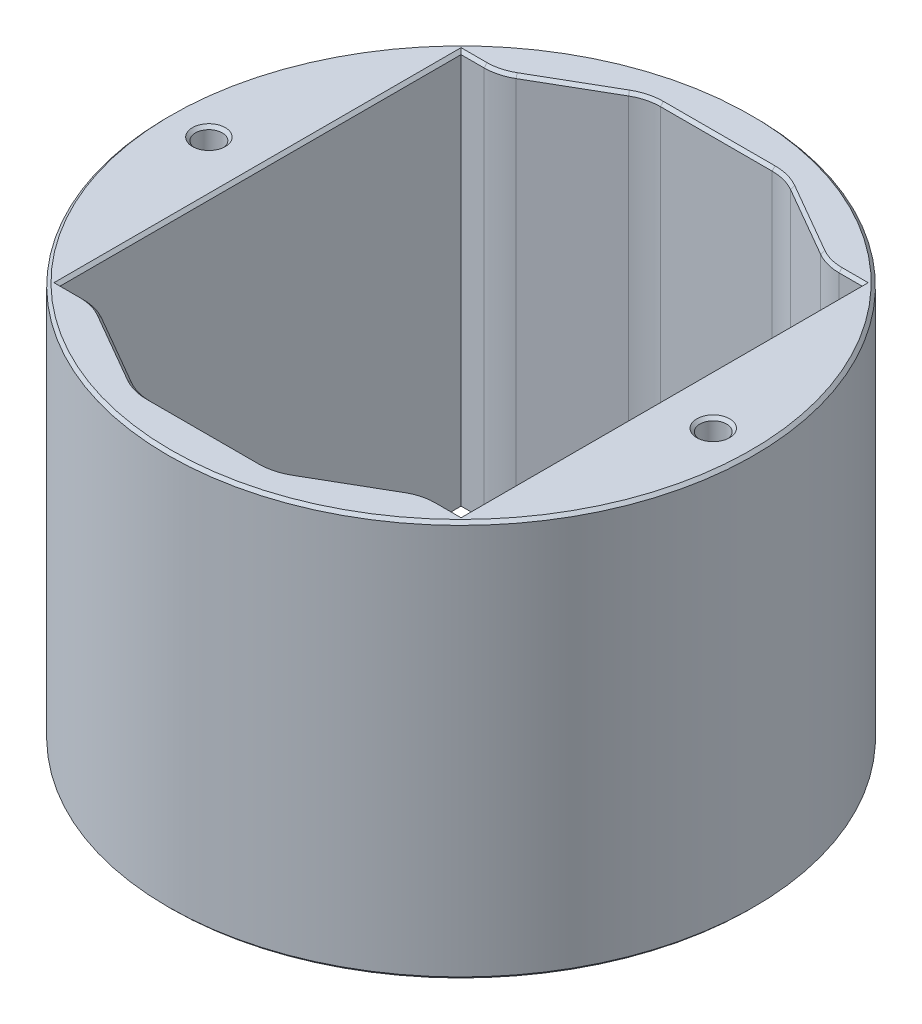
from build123d import *

# Parameters (mm, degrees)
SKETCH1_R           = 73.787
BOSS_EXTRUDE1_DEPTH = 100
SKETCH2_W           = 101
SKETCH2_H           = 101
CUT_EXTRUDE1_DEPTH  = 145.530421497
CUT_EXTRUDE2_DEPTH  = 145.530421497
FILLET1_R           = 12.7
SKETCH4_R           = 3.3782
CUT_EXTRUDE3_DEPTH  = 145.530421497
CHAMFER1_SIZE       = 0.762


with BuildPart() as part:
    # Sketch1 → Boss-Extrude1 (new body)
    with BuildSketch(Plane(origin=(0, 0, 0), x_dir=(1, 0, 0), z_dir=(0, 1, 0))):
        Circle(SKETCH1_R)
    extrude(amount=BOSS_EXTRUDE1_DEPTH)

    # Sketch2 → Cut-Extrude1 (cut, through all)
    with BuildSketch(Plane(origin=(0, 100, 0), x_dir=(1, 0, 0), z_dir=(0, 1, 0))):
        Rectangle(SKETCH2_W, SKETCH2_H)
    extrude(amount=-CUT_EXTRUDE1_DEPTH, mode=Mode.SUBTRACT)

    # Sketch3 → Cut-Extrude2 (cut, through all)
    with BuildSketch(Plane(origin=(0, 100, 0), x_dir=(1, 0, 0), z_dir=(0, 1, 0))):
        Polygon((-17.4625, -64.2619994), (17.4625, -64.2619994), (41.298982175, -50.5), (-41.298982175, -50.5), align=None)
    cut_extrude2 = extrude(amount=-CUT_EXTRUDE2_DEPTH, mode=Mode.SUBTRACT)

    # Mirror1: Cut-Extrude2 across plane
    add(cut_extrude2.mirror(Plane(origin=(0, 0, 0), x_dir=(1, 0, 0), z_dir=(0, 0, -1))), mode=Mode.SUBTRACT)

    # Fillet1
    fillet1_edges = [part.edges().sort_by_distance(p)[0] for p in [
        (17.4625, 50, 64.2619994),
        (41.298982175, 50, 50.5),
        (-17.4625, 50, 64.2619994),
        (-41.298982175, 50, 50.5),
        (41.298982175, 50, -50.5),
        (17.4625, 50, -64.2619994),
        (-17.4625, 50, -64.2619994),
        (-41.298982175, 50, -50.5),
    ]]
    fillet(fillet1_edges, radius=FILLET1_R)

    # Sketch4 → Cut-Extrude3 (cut, through all)
    with BuildSketch(Plane(origin=(0, 100, 0), x_dir=(1, 0, 0), z_dir=(0, 1, 0))):
        with Locations((-63.5, 0)):
            Circle(SKETCH4_R)
        with Locations((63.5, 0)):
            Circle(SKETCH4_R)
    extrude(amount=-CUT_EXTRUDE3_DEPTH, mode=Mode.SUBTRACT)

    # Chamfer1
    chamfer1_edges = [part.edges().sort_by_distance(p)[0] for p in [
        (17.346547129, 0, 63.829257394),
        (0, 0, 64.2619994),
        (-17.346547129, 0, 63.829257394),
        (-29.380741087, 0, 57.3809997),
        (-41.414935046, 0, 50.932742006),
        (-47.600968459, 0, 50.5),
        (-50.5, 0, 0),
        (-47.600968459, 0, -50.5),
        (-41.414935046, 0, -50.932742006),
        (-29.380741087, 0, -57.3809997),
        (-17.346547129, 0, -63.829257394),
        (0, 0, -64.2619994),
        (17.346547129, 0, -63.829257394),
        (29.380741087, 0, -57.3809997),
        (41.414935046, 0, -50.932742006),
        (47.600968459, 0, -50.5),
        (50.5, 0, 0),
        (47.600968459, 0, 50.5),
        (41.414935046, 0, 50.932742006),
        (29.380741087, 0, 57.3809997),
        (-73.787, 0, 0),
        (60.1218, 0, 0),
        (-66.8782, 0, 0),
        (50.5, 100, 0),
        (47.600968459, 100, -50.5),
        (41.414935046, 100, -50.932742006),
        (29.380741087, 100, -57.3809997),
        (17.346547129, 100, -63.829257394),
        (0, 100, -64.2619994),
        (-17.346547129, 100, -63.829257394),
        (-29.380741087, 100, -57.3809997),
        (-41.414935046, 100, -50.932742006),
        (-47.600968459, 100, -50.5),
        (-50.5, 100, 0),
        (-47.600968459, 100, 50.5),
        (-41.414935046, 100, 50.932742006),
        (-29.380741087, 100, 57.3809997),
        (-17.346547129, 100, 63.829257394),
        (0, 100, 64.2619994),
        (17.346547129, 100, 63.829257394),
        (29.380741087, 100, 57.3809997),
        (41.414935046, 100, 50.932742006),
        (47.600968459, 100, 50.5),
        (-73.787, 100, 0),
        (60.1218, 100, 0),
        (-66.8782, 100, 0),
    ]]
    chamfer(chamfer1_edges, length=CHAMFER1_SIZE)


solid = part.part
